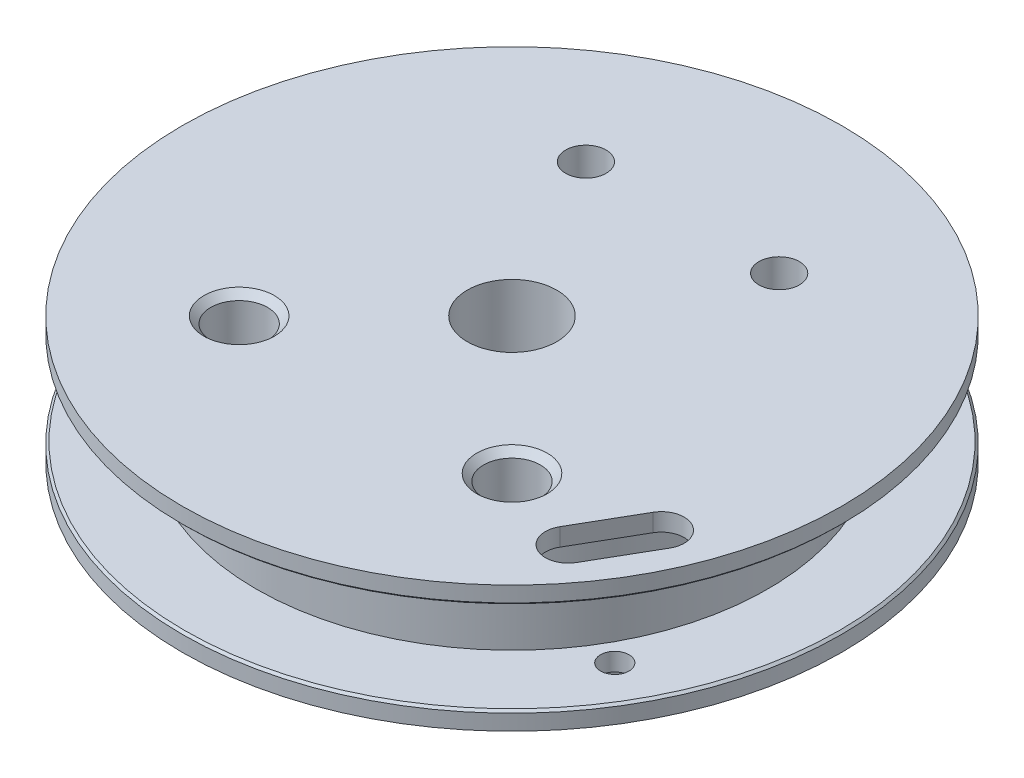
from build123d import *

# Parameters (mm, degrees)
SKETCH7_R                        = 0.79375
CUT_EXTRUDE2_DEPTH               = 2.54
F_1_8_0_125_DIAMETER_HOLE1_D     = 3.175
F_1_8_0_125_DIAMETER_HOLE1_DEPTH = 5.08
F_1_8_0_125_DIAMETER_HOLE1_TIP   = 0.953866233
F_4_40_TAPPED_HOLE1_D            = 2.2606
F_4_40_TAPPED_HOLE1_DEPTH        = 5.715
F_4_40_TAPPED_HOLE1_TIP          = 0.679152758
CUT_EXTRUDE4_REACH               = 31.139
CHAMFER1_SIZE                    = 0.127
CHAMFER2_SIZE                    = 0.381
CUT_EXTRUDE1_REACH               = 46.485
SKETCH2_R                        = 0.635
SKETCH19_W                       = 2.0193
SKETCH19_H                       = 18.415


with BuildPart() as part:
    # Sketch1 → Revolve1 (revolve)
    with BuildSketch(Plane.XY):
        Polygon((-2.5, 22.99396), (-9.525, 22.99396), (-9.525, 28.99396), (-18.415, 28.99396), (-18.415, 29.99396), (-14.2875, 29.99396), (-14.2875, 35.07396), (-18.415, 35.07396), (-18.415, 36.06456), (-2.5, 36.06456), (-2.5, 35.07396), align=None)
    revolve(axis=Axis((0, 0, 0), (0, 1, 0)))

    # Sketch7 → Cut-Extrude2 (cut)
    with BuildSketch(Plane(origin=(0, 29.99396, 0), x_dir=(1, 0, 0), z_dir=(0, 1, 0))):
        with Locations((13.583175446, -7.84225)):
            Circle(SKETCH7_R)
    extrude(amount=-CUT_EXTRUDE2_DEPTH, mode=Mode.SUBTRACT)

    # 1/8 (0.125) Diameter Hole1
    with Locations(Plane(origin=(0, 36.06456, 0), x_dir=(1, 0, 0), z_dir=(0, 1, 0))):
        with Locations((-7.62, -7.62), (7.62, -7.62)):
            Hole(F_1_8_0_125_DIAMETER_HOLE1_D / 2, depth=F_1_8_0_125_DIAMETER_HOLE1_DEPTH)
            with Locations((0, 0, -(F_1_8_0_125_DIAMETER_HOLE1_DEPTH + F_1_8_0_125_DIAMETER_HOLE1_TIP / 2))):  # 118° drill point
                Cone(0, F_1_8_0_125_DIAMETER_HOLE1_D / 2, F_1_8_0_125_DIAMETER_HOLE1_TIP, mode=Mode.SUBTRACT)

    # #4-40 Tapped Hole1
    with Locations(Plane(origin=(0, 36.06456, 0), x_dir=(1, 0, 0), z_dir=(0, 1, 0))):
        with Locations((5.3975, 9.525), (-5.3975, 9.525)):
            Hole(F_4_40_TAPPED_HOLE1_D / 2, depth=F_4_40_TAPPED_HOLE1_DEPTH)
            with Locations((0, 0, -(F_4_40_TAPPED_HOLE1_DEPTH + F_4_40_TAPPED_HOLE1_TIP / 2))):  # 118° drill point
                Cone(0, F_4_40_TAPPED_HOLE1_D / 2, F_4_40_TAPPED_HOLE1_TIP, mode=Mode.SUBTRACT)

    # Sketch14 → Cut-Extrude4 (cut, up to next)
    with BuildSketch(Plane(origin=(0, 36.06456, 0), x_dir=(1, 0, 0), z_dir=(0, 1, 0)), mode=Mode.PRIVATE) as cut_extrude4_sk1:
        with BuildLine():
            Line((15.635527708, -6.827471606), (13.730527708, -10.127028394))
            ThreePointArc((13.730527708, -10.127028394), (11.995675446, -10.591880657), (11.530823183, -8.857028394))
            Line((11.530823183, -8.857028394), (13.435823183, -5.557471606))
            ThreePointArc((13.435823183, -5.557471606), (15.170675446, -5.092619343), (15.635527708, -6.827471606))
        make_face()
    cut_extrude4_tool1 = extrude(cut_extrude4_sk1.sketch, amount=-CUT_EXTRUDE4_REACH, mode=Mode.PRIVATE) & part.part
    add(cut_extrude4_tool1.solids().sort_by_distance((13.583175, 36.06456, 7.84225))[0], mode=Mode.SUBTRACT)

    # Chamfer1
    chamfer1_edges = [part.edges().sort_by_distance(p)[0] for p in [
        (18.415, 35.07396, 0),
        (18.415, 29.99396, 0),
    ]]
    chamfer(chamfer1_edges, length=CHAMFER1_SIZE)

    # Chamfer2
    chamfer2_edges = [part.edges().sort_by_distance(p)[0] for p in [
        (9.2075, 36.06456, 7.62),
        (-6.0325, 36.06456, 7.62),
    ]]
    chamfer(chamfer2_edges, length=CHAMFER2_SIZE)

    # Sketch2 → Cut-Extrude1 (cut, up to next)
    with BuildSketch(Plane.XY, mode=Mode.PRIVATE) as cut_extrude1_sk1:
        with Locations((0, 25.99396)):
            Circle(SKETCH2_R)
    cut_extrude1_tool1 = extrude(cut_extrude1_sk1.sketch, amount=CUT_EXTRUDE1_REACH, mode=Mode.PRIVATE) & part.part
    add(cut_extrude1_tool1.solids().sort_by_distance((0, 25.99396, 0))[0], mode=Mode.SUBTRACT)

    # Sketch19 → #10-32 Tapped Hole1 (revolve, cut)
    with BuildSketch(Plane(origin=(0, 25.99396, 0), x_dir=(0, 1, 0), z_dir=(1, 0, 0))):
        with Locations((1.00965, 9.2075)):
            Rectangle(SKETCH19_W, SKETCH19_H)
    revolve(axis=Axis((0, 25.99396, -6.35), (0, 0, 1)), mode=Mode.SUBTRACT)


solid = part.part
